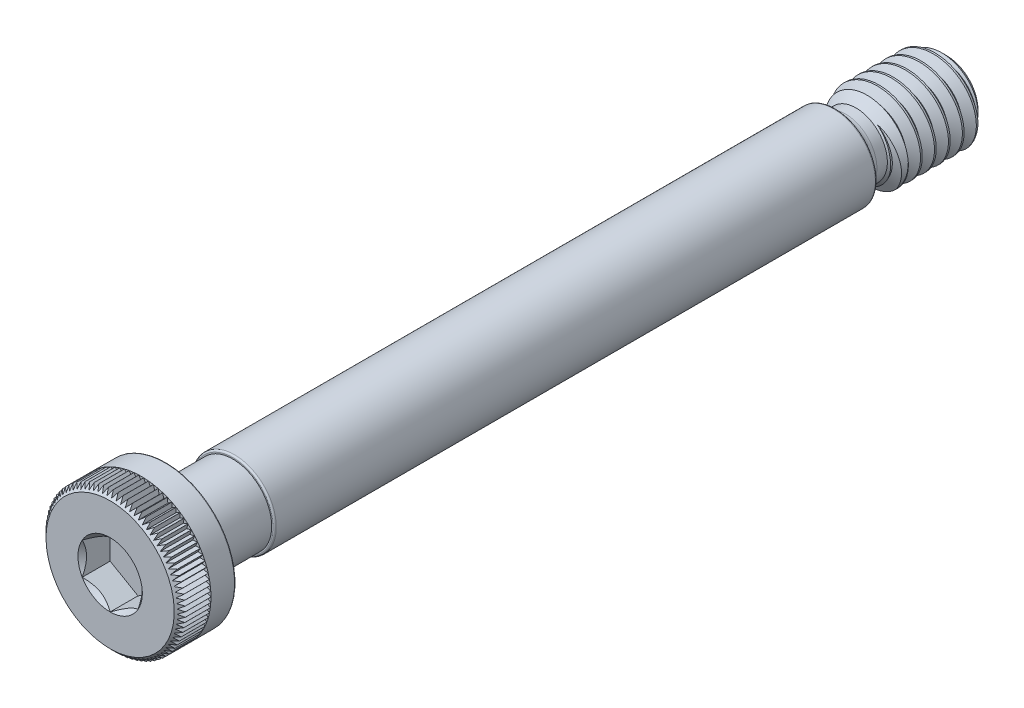
from build123d import *

# Parameters (mm, degrees)
CUT_EXTRUDE2_DEPTH = 1
SKETCH9_R          = 1.154700538
CUT_EXTRUDE4_DEPTH = 1
CUT_EXTRUDE4_DRAFT = -45
CUT_SWEEP1_PITCH   = 0.5
CUT_EXTRUDE5_START = -0.875
CUT_EXTRUDE5_DEPTH = 31.844277718
CIRPATTERN1_COUNT  = 90


with BuildPart() as part:
    # Sketch12 → Revolve1 (revolve)
    with BuildSketch(Plane(origin=(0, 0, 0), x_dir=(0, 0, -1), z_dir=(1, 0, 0)), mode=Mode.PRIVATE) as revolve1_sk:
        with BuildLine():
            Line((-15, 0), (-15, 2.3))
            Line((-15, 2.3), (-14.8, 2.5))
            Line((-14.8, 2.5), (-13.04, 2.5))
            ThreePointArc((-13.04, 2.5), (-13.011715729, 2.488284271), (-13, 2.46))
            Line((-13, 2.46), (-13, 1.395))
            Line((-13, 1.395), (-10.6, 1.395))
            Line((-10.6, 1.395), (-10.6, 1.44))
            ThreePointArc((-10.6, 1.44), (-10.582426407, 1.482426407), (-10.54, 1.5))
            Line((-10.54, 1.5), (10.944157802, 1.5))
            ThreePointArc((10.944157802, 1.5), (10.983549731, 1.485257882), (11.003584312, 1.448275862))
            ThreePointArc((11.003584312, 1.448275862), (11.128800438, 1.217138239), (11.375, 1.125))
            Line((11.375, 1.125), (11.75, 1.125))
            Line((11.75, 1.125), (12.125, 1.5))
            Line((12.125, 1.5), (14.625, 1.5))
            Line((14.625, 1.5), (15, 1.125))
            Line((15, 1.125), (15, 0))
            Line((15, 0), (-15, 0))
        make_face()
    revolve(revolve1_sk.sketch.rotate(Axis((0, 0, -15), (0, 0, 1)), 90), axis=Axis((0, 0, -15), (0, 0, 1)))

    # Sketch8 → Cut-Extrude2 (cut)
    with BuildSketch(Plane.XY.offset(15)):
        Polygon((0, -1.154700538), (1, -0.577350269), (1, 0.577350269), (0, 1.154700538), (-1, 0.577350269), (-1, -0.577350269), align=None)
    extrude(amount=-CUT_EXTRUDE2_DEPTH, mode=Mode.SUBTRACT)


with BuildPart() as cut_extrude4_tool:
    # Sketch9 → Cut-Extrude4 (with draft: the straight prism first)
    with BuildSketch(Plane.XY.offset(15)):
        Circle(SKETCH9_R)
    extrude(amount=-CUT_EXTRUDE4_DEPTH)
    # Cut-Extrude4: the draft: its side faces are tilted about the plane it starts from
    cut_extrude4_sides = [cut_extrude4_tool.faces().sort_by_distance(p)[0] for p in [
        (-1.154700538, 0, 14.5),
    ]]
    draft(cut_extrude4_sides, Plane.XY.offset(15), CUT_EXTRUDE4_DRAFT)


with BuildPart() as part_1:
    add(part.part)

    # Cut-Extrude4: cut by cut_extrude4_tool
    add(cut_extrude4_tool.part, mode=Mode.SUBTRACT)


with BuildPart() as body_2:
    # Split1: the piece on the far side of the plane
    add(part_1.part)
    split(bisect_by=Plane(origin=(0, 0, -11.75), x_dir=(0, -1, 0), z_dir=(0, 0, -1)), keep=Keep.BOTTOM)


with BuildPart() as part_2:
    add(part_1.part)

    # Split1
    split(bisect_by=Plane(origin=(0, 0, -11.75), x_dir=(0, -1, 0), z_dir=(0, 0, -1)), keep=Keep.TOP)

    # Cut-Sweep1: the profile of Sketch13 screwed along a right-hand helix of 8 turns, 6 arcs to a turn; built about Z, then put on its axis
    cut_sweep1_z = Axis((0, 0, 0), (0, 0, 1))
    cut_sweep1_corners = [(1.527063294, 0, 0.015625), (1.527063294, 0, -0.453125), (1.175240474, 0, -0.25), (1.175240474, 0, -0.1875)]
    with BuildLine(mode=Mode.PRIVATE) as cut_sweep1_profile:
        Line(cut_sweep1_corners[0], cut_sweep1_corners[1])
        Line(cut_sweep1_corners[1], cut_sweep1_corners[2])
        Line(cut_sweep1_corners[2], cut_sweep1_corners[3])
        Line(cut_sweep1_corners[3], cut_sweep1_corners[0])
    cut_sweep1_cap = Face(cut_sweep1_profile.wire())
    cut_sweep1_turn_angles = [0, 30, 60, 90, 120, 150, 180, 210, 240, 270, 300, 330, 360]
    cut_sweep1_turn_weights = [1, 0.8660254037844387, 1, 0.8660254037844387, 1, 0.8660254037844387, 1, 0.8660254037844387, 1, 0.8660254037844387, 1, 0.8660254037844387, 1]
    cut_sweep1_turn_rails = [Edge.make_bspline([Vector(p[0], p[1], 0).rotate(cut_sweep1_z, cut_sweep1_turn_angles[k]) / cut_sweep1_turn_weights[k] + Vector(0, 0, p[2] + CUT_SWEEP1_PITCH * cut_sweep1_turn_angles[k] / 360) for k in range(13)], [0, 0, 0, 1, 1, 2, 2, 3, 3, 4, 4, 5, 5, 6, 6, 6], 2, cut_sweep1_turn_weights) for p in cut_sweep1_corners]
    cut_sweep1_turn_sides = [Face.make_surface_from_curves(cut_sweep1_turn_rails[p[0]], cut_sweep1_turn_rails[p[1]]) for p in [(0, 1), (1, 2), (2, 3), (3, 0)]]
    cut_sweep1 = Plane(origin=(0, 0, -15), x_dir=(0, 1, 0), z_dir=(0, 0, 1)) * Solid(Shell([*[p.moved(Location((0, 0, CUT_SWEEP1_PITCH * i))) for i in range(8) for p in cut_sweep1_turn_sides], cut_sweep1_cap, cut_sweep1_cap.rotate(cut_sweep1_z, 2880).moved(Location((0, 0, CUT_SWEEP1_PITCH * 2880 / 360)))]))
    add(cut_sweep1, mode=Mode.SUBTRACT)


with BuildPart() as body_2_1:
    add(body_2.part)

    # Combine1: union part
    add(part_2.part)

    # Sketch11 → Cut-Extrude5 (cut)
    with BuildSketch(Plane.XY.offset(14.76).offset(CUT_EXTRUDE5_START)):
        Polygon((0.087301924, 2.5), (0, 2.348788633), (-0.087301924, 2.5), align=None)
    cut_extrude5 = extrude(amount=CUT_EXTRUDE5_DEPTH, mode=Mode.SUBTRACT)

    # CirPattern1: Cut-Extrude5 ×90 about axis
    cirpattern1_axis = Axis((0, 0, 0), (0, 0, 1))
    for i in range(1, CIRPATTERN1_COUNT):
        add(cut_extrude5.rotate(cirpattern1_axis, i * 360 / CIRPATTERN1_COUNT), mode=Mode.SUBTRACT)


solid = body_2_1.part
